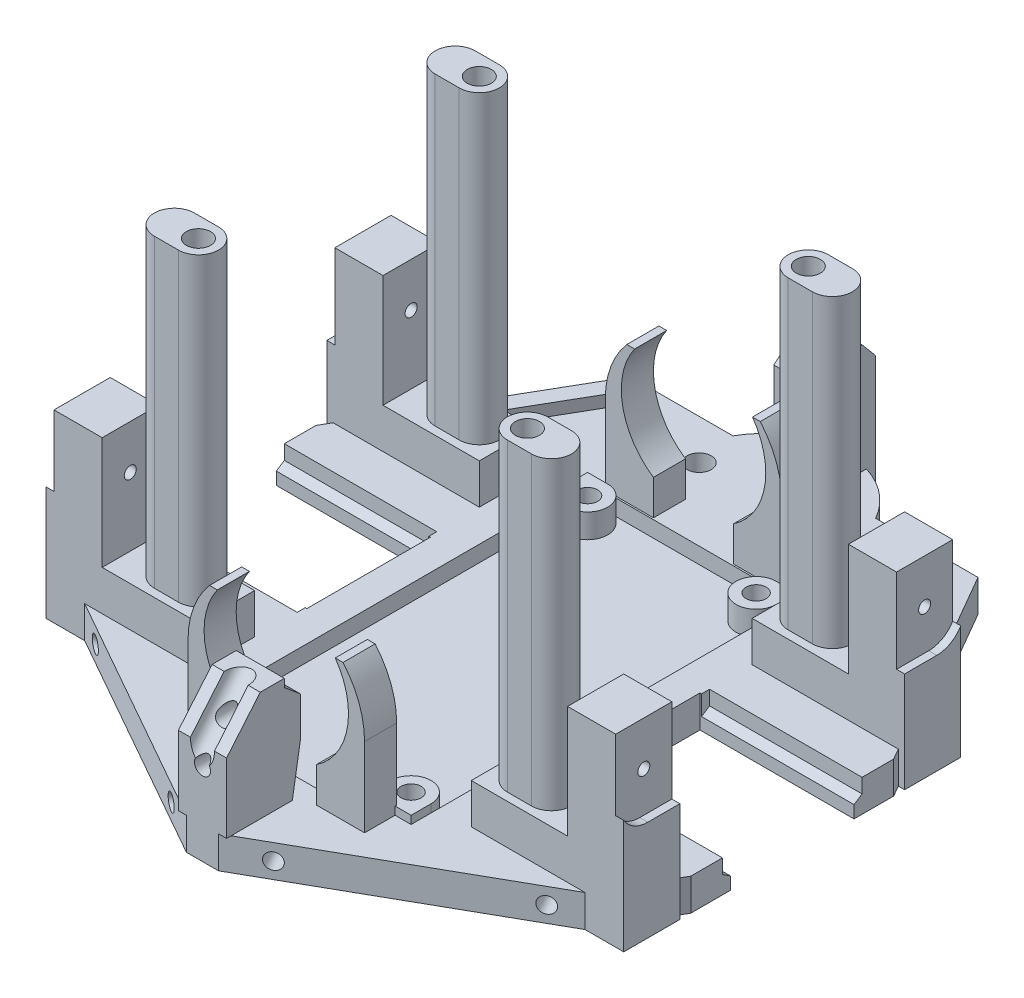
from build123d import *

# Parameters (mm, degrees)
SKETCH1_R                 = 1.5
BOSS_EXTRUDE1_DEPTH       = 4
CUT_EXTRUDE1_DEPTH        = 2
SKETCH8_W                 = 19
SKETCH8_H                 = 7
BOSS_EXTRUDE2_DEPTH       = 19
MOVE_FACE1_BY             = 4
MOVE_FACE1_2_BY           = 4
MOVE_FACE1_3_BY           = 4
MOVE_FACE1_4_BY           = 4
SKETCH11_W                = 19.2
SKETCH11_H                = 14.8
CUT_EXTRUDE3_DEPTH        = 10
CUT_EXTRUDE7_DEPTH        = 1
SKETCH14_W                = 12
SKETCH14_H                = 14
CUT_EXTRUDE8_DEPTH        = 77.698696208
CUT_EXTRUDE9_START        = -1
CUT_EXTRUDE9_DEPTH        = 1
SKETCH31_R                = 0.75
CUT_EXTRUDE15_DEPTH       = 87.811807953
SKETCH26_R                = 1.5
BOSS_EXTRUDE7_DEPTH       = 38
MOVE_START                = 9
MOVE_FACE3_OUTLINE_R      = 1.5
MOVE_FACE3_DEPTH          = 28
CUT_EXTRUDE13_DEPTH       = 19
CUT_EXTRUDE14_DEPTH       = 19
MOVE_START_2              = 17
MOVE_FACE4_DEPTH          = 19
MOVE_START_3              = 16.8
MOVE_FACE4_2_OUTLINE_W    = 4
MOVE_FACE4_2_OUTLINE_H    = 0.3
MOVE_FACE4_2_DEPTH        = 0.2
MOVE_FACE5_DEPTH          = 19
MOVE_FACE5_2_OUTLINE_W    = 4
MOVE_FACE5_2_OUTLINE_H    = 0.3
MOVE_FACE5_2_DEPTH        = 0.2
MOVE_START_4              = -36
MOVE_FACE6_DEPTH          = 19
MOVE_START_5              = -17
MOVE_FACE6_2_OUTLINE_W    = 4
MOVE_FACE6_2_OUTLINE_H    = 0.3
MOVE_FACE6_2_DEPTH        = 0.2
MOVE_FACE7_DEPTH          = 19
MOVE_FACE7_2_OUTLINE_W    = 4
MOVE_FACE7_2_OUTLINE_H    = 0.3
MOVE_FACE7_2_DEPTH        = 0.2
MOVE_START_6              = -35
MOVE_FACE8_OUTLINE_R      = 0.75
MOVE_FACE8_DEPTH          = 6
MOVE_START_7              = 29
MOVE_FACE8_2_OUTLINE_R    = 0.75
MOVE_FACE8_2_DEPTH        = 6
MOVE_FACE8_3_OUTLINE_R    = 0.75
MOVE_FACE8_3_DEPTH        = 6
MOVE_FACE8_4_OUTLINE_R    = 0.75
MOVE_FACE8_4_DEPTH        = 6
CUT_EXTRUDE16_DEPTH       = 4
CUT_EXTRUDE17_DEPTH       = 10
BOSS_EXTRUDE10_DEPTH      = 3
BOSS_EXTRUDE10_DEPTH_BACK = 3
CUT_EXTRUDE20_DEPTH       = 17.5
CUT_EXTRUDE20_DEPTH_BACK  = 19
SKETCH41_R                = 1.5
CUT_EXTRUDE23_DEPTH       = 19
CUT_EXTRUDE23_DEPTH_BACK  = 9.5
BOSS_EXTRUDE11_DEPTH      = 1
BOSS_EXTRUDE11_DEPTH_BACK = 2
BOSS_EXTRUDE12_DEPTH      = 4
SKETCH54_R                = 1.25
CUT_EXTRUDE24_DEPTH       = 4
CUT_EXTRUDE25_DEPTH       = 33
CUT_EXTRUDE25_DEPTH_BACK  = 19
SKETCH51_R                = 1
CUT_EXTRUDE27_DEPTH       = 4
CUT_EXTRUDE28_DEPTH       = 76
CUT_EXTRUDE28_DEPTH_BACK  = 19
SKETCH56_R                = 1
LPATTERN1_COUNT           = 2
LPATTERN1_PITCH           = 52
SKETCH57_R                = 1
CUT_EXTRUDE29_DEPTH       = 7.5
SKETCH45_R                = 1
CUT_EXTRUDE30_DEPTH       = 4


# Read off the part's stored shape, not the designer's step: Move Face3, Move Face4, Move Face5, Move Face6, Move Face7, Move Face8
with BuildPart() as part:
    # Sketch1 → Boss-Extrude1 (new body)
    with BuildSketch(Plane(origin=(0, 0, 0), x_dir=(1, 0, 0), z_dir=(0, 1, 0))):
        with BuildLine():
            Line((-36, 12.646170928), (-36, -12.646170928))
            Line((-36, -12.646170928), (-21.650635095, -37.5))
            Line((-21.650635095, -37.5), (21.650635095, -37.5))
            Line((21.650635095, -37.5), (36, -12.646170928))
            Line((36, -12.646170928), (36, 12.646170928))
            Line((36, 12.646170928), (21.650635095, 37.5))
            Line((21.650635095, 37.5), (8.890444308, 37.5))
            ThreePointArc((8.890444308, 37.5), (0, 42.7), (-8.890444308, 37.5))
            Line((-8.890444308, 37.5), (-21.650635095, 37.5))
            Line((-21.650635095, 37.5), (-36, 12.646170928))
        make_face()
        with Locations(Location((-8.1, 32.5, 0), (0, 0, 270))):
            Circle(SKETCH1_R, mode=Mode.SUBTRACT)
        with Locations(Location((8.1, 32.5, 0), (0, 0, 270))):
            Circle(SKETCH1_R, mode=Mode.SUBTRACT)
    extrude(amount=BOSS_EXTRUDE1_DEPTH)

    # Sketch6 → Cut-Extrude1 (cut)
    with BuildSketch(Plane(origin=(0, 4, 0), x_dir=(1, 0, 0), z_dir=(0, 1, 0))):
        Polygon((-13, -24.5), (-5, -24.5), (-5, -26.5), (5, -26.5), (5, -24.5), (13, -24.5), (13, 23.5), (-13, 23.5), align=None)
    extrude(amount=-CUT_EXTRUDE1_DEPTH, mode=Mode.SUBTRACT)

    # Sketch8 → Boss-Extrude2 (add)
    with BuildSketch(Plane(origin=(0, 4, 0), x_dir=(1, 0, 0), z_dir=(0, 1, 0))):
        with Locations((-26.5, 17.5)):
            Rectangle(SKETCH8_W, SKETCH8_H)
        with Locations((-26.5, -17.5)):
            Rectangle(SKETCH8_W, SKETCH8_H)
        with Locations((26.5, -17.5)):
            Rectangle(SKETCH8_W, SKETCH8_H)
        with Locations((26.5, 17.5)):
            Rectangle(SKETCH8_W, SKETCH8_H)
    extrude(amount=BOSS_EXTRUDE2_DEPTH)

    # Move Face1: a face moved outward by 4.0
    extrude(part.faces().sort_by_distance((34.355969331, 4, 18.341260224))[0], amount=MOVE_FACE1_BY, dir=(0, -1, 0))

    # Move Face1 2: a face moved outward by 4.0
    extrude(part.faces().sort_by_distance((34.355969331, 4, -18.341260224))[0], amount=MOVE_FACE1_2_BY, dir=(0, -1, 0))

    # Move Face1 3: a face moved outward by 4.0
    extrude(part.faces().sort_by_distance((-34.355969331, 4, -18.341260224))[0], amount=MOVE_FACE1_3_BY, dir=(0, -1, 0))

    # Move Face1 4: a face moved outward by 4.0
    extrude(part.faces().sort_by_distance((-34.355969331, 4, 18.341260224))[0], amount=MOVE_FACE1_4_BY, dir=(0, -1, 0))

    # Sketch11 → Cut-Extrude3 (cut)
    with BuildSketch(Plane(origin=(0, 4, 0), x_dir=(1, 0, 0), z_dir=(0, 1, 0))):
        with Locations((-26.4, 0)):
            Rectangle(SKETCH11_W, SKETCH11_H)
        with Locations((26.4, 0)):
            Rectangle(SKETCH11_W, SKETCH11_H)
    extrude(amount=-CUT_EXTRUDE3_DEPTH, mode=Mode.SUBTRACT)

    # Sketch13 → Cut-Extrude7 (cut)
    with BuildSketch(Plane(origin=(36, 0, 0), x_dir=(0, 0, -1), z_dir=(1, 0, 0))):
        with BuildLine():
            Line((-14, 19.5), (-14, 12.5))
            Line((-14, 12.5), (-18, 12.5))
            ThreePointArc((-18, 12.5), (-21.046285831, 14.276589824), (-21, 17.802775638))
            Line((-21, 17.802775638), (-21, 23))
            Line((-21, 23), (-14, 23))
            Line((-14, 23), (-14, 19.5))
        make_face()
        with BuildLine():
            Line((14, 12.5), (18, 12.5))
            ThreePointArc((18, 12.5), (21.046285831, 14.276589824), (21, 17.802775638))
            Line((21, 17.802775638), (21, 23))
            Line((21, 23), (14, 23))
            Line((14, 23), (14, 19.5))
            Line((14, 19.5), (14, 12.5))
        make_face()
    extrude(amount=-CUT_EXTRUDE7_DEPTH, mode=Mode.SUBTRACT)

    # Sketch14 → Cut-Extrude8 (cut, through all)
    with BuildSketch(Plane.XY.offset(21)):
        with Locations((23, 16)):
            Rectangle(SKETCH14_W, SKETCH14_H)
        with Locations((-23, 16)):
            Rectangle(SKETCH14_W, SKETCH14_H)
    extrude(amount=-CUT_EXTRUDE8_DEPTH, mode=Mode.SUBTRACT)

    # Sketch18 → Cut-Extrude9 (cut)
    with BuildSketch(Plane.ZY.offset(36).offset(CUT_EXTRUDE9_START)):
        with BuildLine():
            Line((-14, 19.5), (-14, 12.5))
            Line((-14, 12.5), (-18, 12.5))
            ThreePointArc((-18, 12.5), (-21.046285831, 14.276589824), (-21, 17.802775638))
            Line((-21, 17.802775638), (-21, 23))
            Line((-21, 23), (-14, 23))
            Line((-14, 23), (-14, 19.5))
        make_face()
        with BuildLine():
            Line((14, 19.5), (14, 12.5))
            Line((14, 12.5), (18, 12.5))
            ThreePointArc((18, 12.5), (21.046285831, 14.276589824), (21, 17.802775638))
            Line((21, 17.802775638), (21, 23))
            Line((21, 23), (14, 23))
            Line((14, 23), (14, 19.5))
        make_face()
    extrude(amount=CUT_EXTRUDE9_DEPTH, mode=Mode.SUBTRACT)

    # Sketch31 → Cut-Extrude15 (cut, through all)
    with BuildSketch(Plane(origin=(36, 0, 0), x_dir=(0, 0, -1), z_dir=(1, 0, 0))):
        with Locations((-17.500000001, 16)):
            Circle(SKETCH31_R)
        with Locations(Location((17.500000001, 16, 0), (0, 0, 180))):
            Circle(SKETCH31_R)
    extrude(amount=-CUT_EXTRUDE15_DEPTH, mode=Mode.SUBTRACT)

    # Sketch26 → Boss-Extrude7 (add)
    # profile 1 of 4: a face of its own
    with BuildSketch(Plane(origin=(0, 9, 0), x_dir=(1, 0, 0), z_dir=(0, 1, 0))):
        with BuildLine():
            Line((-20.5, 20), (-23.5, 20))
            ThreePointArc((-23.5, 20), (-26, 17.5), (-23.5, 15))
            Line((-23.5, 15), (-20.5, 15))
            ThreePointArc((-20.5, 15), (-18, 17.5), (-20.5, 20))
        make_face()
        with Locations(Location((-20.5, 17.5, 0), (0, 0, 270))):
            Circle(SKETCH26_R, mode=Mode.SUBTRACT)
    # profile 2 of 4: a face of its own
    with BuildSketch(Plane(origin=(0, 9, 0), x_dir=(1, 0, 0), z_dir=(0, 1, 0))):
        with BuildLine():
            Line((20.5, 15), (23.5, 15))
            ThreePointArc((23.5, 15), (26, 17.5), (23.5, 20))
            Line((23.5, 20), (20.5, 20))
            ThreePointArc((20.5, 20), (18, 17.5), (20.5, 15))
        make_face()
        with Locations(Location((20.5, 17.5, 0), (0, 0, 90))):
            Circle(SKETCH26_R, mode=Mode.SUBTRACT)
    # profile 3 of 4: a face of its own
    with BuildSketch(Plane(origin=(0, 9, 0), x_dir=(1, 0, 0), z_dir=(0, 1, 0))):
        with BuildLine():
            Line((20.5, -20), (23.5, -20))
            ThreePointArc((23.5, -20), (26, -17.5), (23.5, -15))
            Line((23.5, -15), (20.5, -15))
            ThreePointArc((20.5, -15), (18, -17.5), (20.5, -20))
        make_face()
        with Locations(Location((20.5, -17.5, 0), (0, 0, 270))):
            Circle(SKETCH26_R, mode=Mode.SUBTRACT)
    # profile 4 of 4: a face of its own
    with BuildSketch(Plane(origin=(0, 9, 0), x_dir=(1, 0, 0), z_dir=(0, 1, 0))):
        with BuildLine():
            Line((-20.5, -15), (-23.5, -15))
            ThreePointArc((-23.5, -15), (-26, -17.5), (-23.5, -20))
            Line((-23.5, -20), (-20.5, -20))
            ThreePointArc((-20.5, -20), (-18, -17.5), (-20.5, -15))
        make_face()
        with Locations(Location((-20.5, -17.5, 0), (0, 0, 90))):
            Circle(SKETCH26_R, mode=Mode.SUBTRACT)
    extrude(amount=BOSS_EXTRUDE7_DEPTH)

    # Move Face3 outline → Move Face3 (add)
    with BuildSketch(Plane(origin=(0, 0, 0), x_dir=(1, 0, 0), z_dir=(0, 1, 0)).offset(MOVE_START)):
        with Locations((-20.5, 17.5)):
            Circle(MOVE_FACE3_OUTLINE_R)
        with Locations((20.5, -17.5)):
            Circle(MOVE_FACE3_OUTLINE_R)
        with Locations((-20.5, -17.5)):
            Circle(MOVE_FACE3_OUTLINE_R)
    extrude(amount=MOVE_FACE3_DEPTH)

    # Sketch29 → Cut-Extrude13 (cut)
    with BuildSketch(Plane.ZY.offset(36)):
        Polygon((-8.4, 4), (-8.4, 2.2), (-7.4, 1.55), (-7.4, 4), align=None)
        Polygon((8.4, 4), (7.4, 4), (7.4, 1.55), (8.4, 2.2), align=None)
    extrude(amount=-CUT_EXTRUDE13_DEPTH, mode=Mode.SUBTRACT)

    # Sketch30 → Cut-Extrude14 (cut)
    with BuildSketch(Plane(origin=(36, 0, 0), x_dir=(0, 0, -1), z_dir=(1, 0, 0))):
        Polygon((-7.4, 4), (-8.4, 4), (-8.4, 2.2), (-7.4, 1.55), align=None)
        Polygon((7.4, 4), (8.4, 4), (8.4, 2.2), (7.4, 1.55), align=None)
    extrude(amount=-CUT_EXTRUDE14_DEPTH, mode=Mode.SUBTRACT)

    # Move Face4 outline → Move Face4 (cut)
    with BuildSketch(Plane.YZ.offset(MOVE_START_2)):
        Polygon((0, -7.4), (0, -7.7), (1.55, -7.7), (2.2, -8.7), (4, -8.7), (4, -8.4), (2.2, -8.4), (1.55, -7.4), align=None)
    extrude(amount=MOVE_FACE4_DEPTH, mode=Mode.SUBTRACT)

    # Move Face4 2 outline → Move Face4 2 (cut)
    with BuildSketch(Plane.YZ.offset(MOVE_START_3)):
        with Locations((2, -7.55)):
            Rectangle(MOVE_FACE4_2_OUTLINE_W, MOVE_FACE4_2_OUTLINE_H)
    extrude(amount=MOVE_FACE4_2_DEPTH, mode=Mode.SUBTRACT)

    # Move Face5 outline → Move Face5 (cut)
    with BuildSketch(Plane.YZ.offset(MOVE_START_2)):
        Polygon((1.55, 7.4), (2.2, 8.4), (4, 8.4), (4, 8.7), (2.2, 8.7), (1.55, 7.7), (0, 7.7), (0, 7.4), align=None)
    extrude(amount=MOVE_FACE5_DEPTH, mode=Mode.SUBTRACT)

    # Move Face5 2 outline → Move Face5 2 (cut)
    with BuildSketch(Plane.YZ.offset(MOVE_START_3)):
        with Locations((2, 7.55)):
            Rectangle(MOVE_FACE5_2_OUTLINE_W, MOVE_FACE5_2_OUTLINE_H)
    extrude(amount=MOVE_FACE5_2_DEPTH, mode=Mode.SUBTRACT)

    # Move Face6 outline → Move Face6 (cut)
    with BuildSketch(Plane.YZ.offset(MOVE_START_4)):
        Polygon((0, -7.4), (0, -7.7), (1.55, -7.7), (2.2, -8.7), (4, -8.7), (4, -8.4), (2.2, -8.4), (1.55, -7.4), align=None)
    extrude(amount=MOVE_FACE6_DEPTH, mode=Mode.SUBTRACT)

    # Move Face6 2 outline → Move Face6 2 (cut)
    with BuildSketch(Plane.YZ.offset(MOVE_START_5)):
        with Locations((2, -7.55)):
            Rectangle(MOVE_FACE6_2_OUTLINE_W, MOVE_FACE6_2_OUTLINE_H)
    extrude(amount=MOVE_FACE6_2_DEPTH, mode=Mode.SUBTRACT)

    # Move Face7 outline → Move Face7 (cut)
    with BuildSketch(Plane.YZ.offset(MOVE_START_4)):
        Polygon((1.55, 7.4), (2.2, 8.4), (4, 8.4), (4, 8.7), (2.2, 8.7), (1.55, 7.7), (0, 7.7), (0, 7.4), align=None)
    extrude(amount=MOVE_FACE7_DEPTH, mode=Mode.SUBTRACT)

    # Move Face7 2 outline → Move Face7 2 (cut)
    with BuildSketch(Plane.YZ.offset(MOVE_START_5)):
        with Locations((2, 7.55)):
            Rectangle(MOVE_FACE7_2_OUTLINE_W, MOVE_FACE7_2_OUTLINE_H)
    extrude(amount=MOVE_FACE7_2_DEPTH, mode=Mode.SUBTRACT)

    # Move Face8 outline → Move Face8 (cut)
    with BuildSketch(Plane.YZ.offset(MOVE_START_6)):
        with Locations((17.5, -17.500000001)):
            Circle(MOVE_FACE8_OUTLINE_R)
        with Locations((17.5, 17.500000001)):
            Circle(MOVE_FACE8_OUTLINE_R)
    extrude(amount=MOVE_FACE8_DEPTH, mode=Mode.SUBTRACT)

    # Move Face8 2 outline → Move Face8 2 (cut)
    with BuildSketch(Plane.YZ.offset(MOVE_START_7)):
        with Locations((17.5, -17.500000001)):
            Circle(MOVE_FACE8_2_OUTLINE_R)
        with Locations((17.5, 17.500000001)):
            Circle(MOVE_FACE8_2_OUTLINE_R)
    extrude(amount=MOVE_FACE8_2_DEPTH, mode=Mode.SUBTRACT)

    # Move Face8 3 outline → Move Face8 3 (add)
    with BuildSketch(Plane.YZ.offset(MOVE_START_6)):
        with Locations((16, -17.500000001)):
            Circle(MOVE_FACE8_3_OUTLINE_R)
        with Locations((16, 17.500000001)):
            Circle(MOVE_FACE8_3_OUTLINE_R)
    extrude(amount=MOVE_FACE8_3_DEPTH)

    # Move Face8 4 outline → Move Face8 4 (add)
    with BuildSketch(Plane.YZ.offset(MOVE_START_7)):
        with Locations((16, -17.500000001)):
            Circle(MOVE_FACE8_4_OUTLINE_R)
        with Locations((16, 17.500000001)):
            Circle(MOVE_FACE8_4_OUTLINE_R)
    extrude(amount=MOVE_FACE8_4_DEPTH)

    # Sketch32 → Cut-Extrude16 (cut)
    with BuildSketch(Plane(origin=(0, 4, 0), x_dir=(1, 0, 0), z_dir=(0, 1, 0))):
        Polygon((-20.902851296, 34.758865746), (-25.902851296, 26.098611708), (-24.170800488, 25.098611708), (-19.170800488, 33.758865746), align=None)
        Polygon((24.170800488, 25.098611708), (19.170800488, 33.758865746), (20.902851296, 34.758865746), (25.902851296, 26.098611708), align=None)
    extrude(amount=-CUT_EXTRUDE16_DEPTH, mode=Mode.SUBTRACT)

    # Sketch34 → Cut-Extrude17 (cut)
    with BuildSketch(Plane(origin=(0, 4, 0), x_dir=(1, 0, 0), z_dir=(0, 1, 0))):
        Polygon((-31.176914536, -21), (-2, -37.5), (-21.650635095, -37.5), align=None)
        Polygon((2, -37.5), (21.650635095, -37.5), (31.176914536, -21), align=None)
    extrude(amount=-CUT_EXTRUDE17_DEPTH, mode=Mode.SUBTRACT)

    # Sketch36 → Boss-Extrude10 (add, two sides: drawn at the far end of the back side and taken through both)
    with BuildSketch(Plane(origin=(0, 0, 0), x_dir=(0, 0, -1), z_dir=(1, 0, 0)).offset(-BOSS_EXTRUDE10_DEPTH_BACK)):
        Polygon((-29.3, 4), (-37.5, 4), (-37.5, 12.672834173), (-33.3, 17.678199262), (-30.3, 17.678199262), (-30.3, 16.678199262), (-28.3, 15), (-28.3, 10), align=None)
        Polygon((36.7, 10), (37.7, 4), (42.15, 4), (42.15, 0), (45.9, 0), (45.9, 12.672834173), (41.7, 17.678199262), (38.7, 17.678199262), (38.7, 16.678199262), (36.7, 15), align=None)
    extrude(amount=BOSS_EXTRUDE10_DEPTH + BOSS_EXTRUDE10_DEPTH_BACK)

    # Sketch41 → Cut-Extrude20 (cut, two sides: drawn at the far end of the back side and taken through both)
    with BuildSketch(Plane(origin=(0, -4.545844284, 3.814416262), x_dir=(1, 0, 0), z_dir=(0, -0.7660444431189833, 0.6427876096865333)).offset(-CUT_EXTRUDE20_DEPTH_BACK)):
        with Locations((0, 36.872607403)):
            Circle(SKETCH41_R)
    extrude(amount=CUT_EXTRUDE20_DEPTH + CUT_EXTRUDE20_DEPTH_BACK, mode=Mode.SUBTRACT)

    # Sketch44 → Cut-Extrude23 (cut, two sides: drawn at the far end of the back side and taken through both)
    with BuildSketch(Plane(origin=(0, 10.014016341, 1.765741266), x_dir=(1, 0, 0), z_dir=(0, 0.9848077530122091, 0.1736481776669247)).offset(-CUT_EXTRUDE23_DEPTH_BACK)):
        with BuildLine():
            Line((-1.5, 44.536270387), (-1.5, 48.250028306))
            Line((-1.5, 48.250028306), (1.5, 48.250028306))
            Line((1.5, 48.250028306), (1.5, 44.536270387))
            ThreePointArc((1.5, 44.536270387), (0, 43.036270387), (-1.5, 44.536270387))
        make_face()
    extrude(amount=CUT_EXTRUDE23_DEPTH + CUT_EXTRUDE23_DEPTH_BACK, mode=Mode.SUBTRACT)

    # Sketch22 → Boss-Extrude11 (add, two sides: drawn at the far end of the back side and taken through both)
    with BuildSketch(Plane(origin=(0, 4, 0), x_dir=(1, 0, 0), z_dir=(0, 1, 0)).offset(-BOSS_EXTRUDE11_DEPTH_BACK)):
        with BuildLine():
            Line((-13, 23.5), (-10.5, 23.5))
            ThreePointArc((-10.5, 23.5), (-8.732233047, 19.232233047), (-13, 21))
            Line((-13, 21), (-13, 23.5))
        make_face()
        with BuildLine():
            Line((10.5, 23.5), (13, 23.5))
            Line((13, 23.5), (13, 21))
            ThreePointArc((13, 21), (8.732233047, 19.232233047), (10.5, 23.5))
        make_face()
        with BuildLine():
            Line((13, -24.5), (10.5, -24.5))
            ThreePointArc((10.5, -24.5), (8.732233047, -20.232233047), (13, -22))
            Line((13, -22), (13, -24.5))
        make_face()
        with BuildLine():
            Line((-13, -24.5), (-10.5, -24.5))
            ThreePointArc((-10.5, -24.5), (-8.732233047, -20.232233047), (-13, -22))
            Line((-13, -22), (-13, -24.5))
        make_face()
    extrude(amount=BOSS_EXTRUDE11_DEPTH + BOSS_EXTRUDE11_DEPTH_BACK)

    # Sketch53 → Boss-Extrude12 (add)
    with BuildSketch(Plane(origin=(0, 0, 28.3), x_dir=(-1, 0, 0), z_dir=(0, 0, -1))):
        with BuildLine():
            Line((-11, 13.85), (-11, 4))
            Line((-11, 4), (-5, 4))
            Line((-5, 4), (-5, 8.366685226))
            ThreePointArc((-5, 8.366685226), (-8.849914468, 14.213230646), (-7.345747069, 21.05))
            Line((-7.345747069, 21.05), (-8.316249155, 21.05))
            ThreePointArc((-8.316249155, 21.05), (-10.307248437, 17.691956487), (-11, 13.85))
        make_face()
        with BuildLine():
            Line((11, 4), (11, 13.85))
            ThreePointArc((11, 13.85), (10.307248437, 17.691956487), (8.316249155, 21.05))
            Line((8.316249155, 21.05), (7.345747069, 21.05))
            ThreePointArc((7.345747069, 21.05), (8.849914468, 14.213230646), (5, 8.366685226))
            Line((5, 8.366685226), (5, 4))
            Line((5, 4), (11, 4))
        make_face()
    boss_extrude12 = extrude(amount=BOSS_EXTRUDE12_DEPTH)

    # Sketch54 → Cut-Extrude24 (cut)
    with BuildSketch(Plane(origin=(0, 5, 0), x_dir=(1, 0, 0), z_dir=(0, 1, 0))):
        with Locations(Location((10.5, -22, 0), (0, 0, 270))):
            Circle(SKETCH54_R)
        with Locations(Location((-10.5, -22, 0), (0, 0, 270))):
            Circle(SKETCH54_R)
        with Locations(Location((-10.5, 21, 0), (0, 0, 270))):
            Circle(SKETCH54_R)
        with Locations(Location((10.5, 21, 0), (0, 0, 270))):
            Circle(SKETCH54_R)
    extrude(amount=-CUT_EXTRUDE24_DEPTH, mode=Mode.SUBTRACT)

    # Sketch55 → Cut-Extrude25 (cut, two sides: drawn at the far end of the back side and taken through both)
    with BuildSketch(Plane(origin=(0, 4, 0), x_dir=(1, 0, 0), z_dir=(0, 1, 0)).offset(-CUT_EXTRUDE25_DEPTH_BACK)):
        Polygon((-3, 45.9), (3, 45.9), (3, 43.4), (0, 44.114320351), (-3, 43.4), align=None)
    extrude(amount=CUT_EXTRUDE25_DEPTH + CUT_EXTRUDE25_DEPTH_BACK, mode=Mode.SUBTRACT)

    # Sketch51 → Cut-Extrude27 (cut)
    with BuildSketch(Plane(origin=(16.552750329, 0, 29.27019283), x_dir=(0.8704516268772419, 0, -0.49225396419608747), z_dir=(0.4922539641960875, 0, 0.870451626877242))):
        with Locations((-11.699337269, 2)):
            Circle(SKETCH51_R)
        with Locations((13.300662731, 2)):
            Circle(SKETCH51_R)
    extrude(amount=-CUT_EXTRUDE27_DEPTH, mode=Mode.SUBTRACT)

    # Sketch56 → Cut-Extrude28 (cut, two sides: drawn at the far end of the back side and taken through both)
    with BuildSketch(Plane(origin=(0, 0, 28.3), x_dir=(-1, 0, 0), z_dir=(0, 0, -1)).offset(-CUT_EXTRUDE28_DEPTH_BACK)):
        with Locations(Location((0, 14.25, 0), (0, 0, 270))):
            Circle(SKETCH56_R)
        with Locations(Location((0, 10.25, 0), (0, 0, 270))):
            Circle(SKETCH56_R)
    extrude(amount=CUT_EXTRUDE28_DEPTH + CUT_EXTRUDE28_DEPTH_BACK, mode=Mode.SUBTRACT)

    # LPattern1: Boss-Extrude12 ×2
    with Locations(*[(0, 0, -i * LPATTERN1_PITCH) for i in range(1, LPATTERN1_COUNT)]):
        add(boss_extrude12)

    # Sketch57 → Cut-Extrude29 (cut)
    with BuildSketch(Plane(origin=(0, 17.678199262, 0), x_dir=(1, 0, 0), z_dir=(0, 1, 0))):
        with Locations((0, -28.3)):
            Circle(SKETCH57_R)
        with Locations((0, 36.7)):
            Circle(SKETCH57_R)
    extrude(amount=-CUT_EXTRUDE29_DEPTH, mode=Mode.SUBTRACT)

    # Sketch45 → Cut-Extrude30 (cut)
    with BuildSketch(Plane(origin=(-16.552750329, 0, 29.27019283), x_dir=(0.8704516268772419, 0, 0.49225396419608747), z_dir=(-0.4922539641960875, 0, 0.870451626877242))):
        with Locations((-13.300662731, 2)):
            Circle(SKETCH45_R)
        with Locations((11.699337269, 2)):
            Circle(SKETCH45_R)
    extrude(amount=-CUT_EXTRUDE30_DEPTH, mode=Mode.SUBTRACT)


solid = part.part
